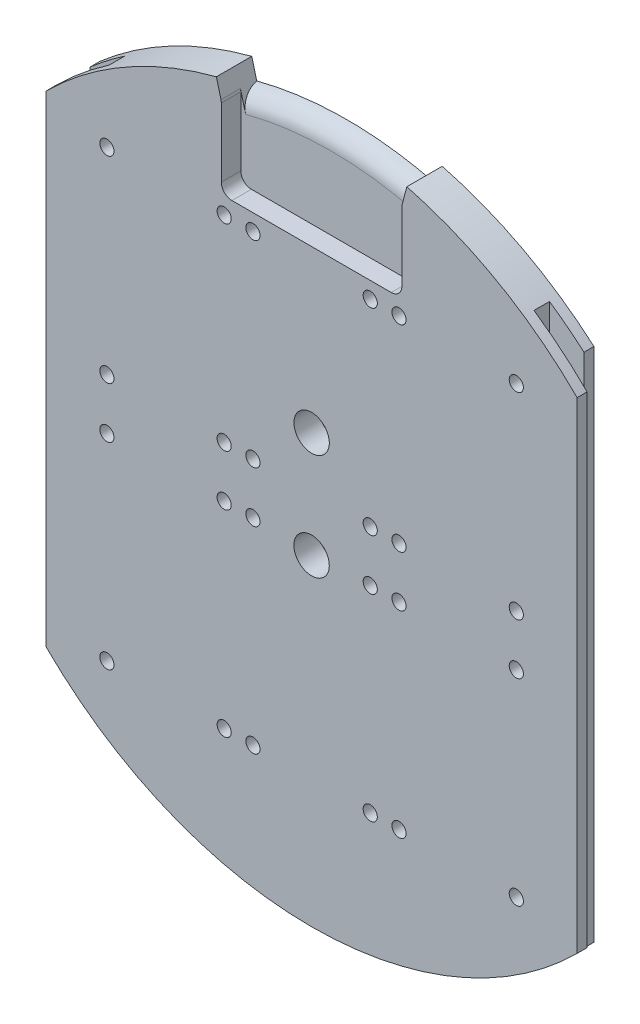
from build123d import *

# Parameters (mm, degrees)
RESSALTO_EXTRUS_O1_DEPTH = 8
ESBO_O5_R                = 4
CORTE_EXTRUS_O3_DEPTH    = 5.6
ESBO_O7_R                = 1.6
CORTE_EXTRUS_O4_DEPTH    = 180.714977127
CORTE_EXTRUS_O6_DEPTH    = 180.714977127
CORTE_EXTRUS_O7_DEPTH    = 4.4
FILETE1_R                = 2.4
FILETE2_R                = 4.4
ESBO_O11_W               = 3.5
ESBO_O11_H               = 150
CORTE_EXTRUS_O8_DEPTH    = 12
ESBO_O12_W               = 3.5
ESBO_O12_H               = 150
CORTE_EXTRUS_O9_DEPTH    = 12
ESBO_O13_W               = 4.4
ESBO_O13_H               = 156.816425971
CORTE_EXTRUS_O10_DEPTH   = 5.75


with BuildPart() as part:
    # Esboço1 → Ressalto-extrusão1 (new body)
    with BuildSketch(Plane.XY):
        with BuildLine():
            Line((0, 0), (0, -108.75))
            ThreePointArc((0, -108.75), (60, -133.542027106), (120, -108.75))
            Line((120, -108.75), (120, 0))
            ThreePointArc((120, 0), (60, 24.792027106), (0, 0))
        make_face()
    extrude(amount=RESSALTO_EXTRUS_O1_DEPTH)

    # Esboço5 → Corte-extrusão3 (cut)
    with BuildSketch(Plane.XY.offset(8)):
        with Locations((60, -60.875)):
            Circle(ESBO_O5_R)
        with Locations(Location((60, -36.875, 0), (0, 0, 180))):
            Circle(ESBO_O5_R)
    extrude(amount=-CORTE_EXTRUS_O3_DEPTH, mode=Mode.SUBTRACT)

    # Esboço7 → Corte-extrusão4 (cut, through all)
    with BuildSketch(Plane(origin=(0, 0, 0), x_dir=(-1, 0, 0), z_dir=(0, 0, -1))):
        with Locations((-73.25, -48.625)):
            Circle(ESBO_O7_R)
        with Locations((-79.75, -48.625)):
            Circle(ESBO_O7_R)
        with Locations((-106.25, -48.625)):
            Circle(ESBO_O7_R)
        with Locations(Location((-73.25, -4.125, 0), (0, 0, 180))):
            Circle(ESBO_O7_R)
        with Locations(Location((-106.25, -4.125, 0), (0, 0, 180))):
            Circle(ESBO_O7_R)
        with Locations(Location((-79.75, -4.125, 0), (0, 0, 180))):
            Circle(ESBO_O7_R)
        with Locations((-40.25, -4.125)):
            Circle(ESBO_O7_R)
        with Locations((-13.75, -4.125)):
            Circle(ESBO_O7_R)
        with Locations((-46.75, -4.125)):
            Circle(ESBO_O7_R)
        with Locations(Location((-13.75, -48.625, 0), (0, 0, 180))):
            Circle(ESBO_O7_R)
        with Locations(Location((-40.25, -48.625, 0), (0, 0, 180))):
            Circle(ESBO_O7_R)
        with Locations(Location((-46.75, -48.625, 0), (0, 0, 180))):
            Circle(ESBO_O7_R)
        with Locations((-46.75, -60.125)):
            Circle(ESBO_O7_R)
        with Locations((-40.25, -60.125)):
            Circle(ESBO_O7_R)
        with Locations((-13.75, -60.125)):
            Circle(ESBO_O7_R)
        with Locations(Location((-46.75, -104.625, 0), (0, 0, 180))):
            Circle(ESBO_O7_R)
        with Locations(Location((-13.75, -104.625, 0), (0, 0, 180))):
            Circle(ESBO_O7_R)
        with Locations(Location((-40.25, -104.625, 0), (0, 0, 180))):
            Circle(ESBO_O7_R)
        with Locations((-79.75, -104.625)):
            Circle(ESBO_O7_R)
        with Locations((-106.25, -104.625)):
            Circle(ESBO_O7_R)
        with Locations((-73.25, -104.625)):
            Circle(ESBO_O7_R)
        with Locations(Location((-106.25, -60.125, 0), (0, 0, 180))):
            Circle(ESBO_O7_R)
        with Locations(Location((-79.75, -60.125, 0), (0, 0, 180))):
            Circle(ESBO_O7_R)
        with Locations(Location((-73.25, -60.125, 0), (0, 0, 180))):
            Circle(ESBO_O7_R)
    extrude(amount=-CORTE_EXTRUS_O4_DEPTH, mode=Mode.SUBTRACT)

    # Esboço9 → Corte-extrusão6 (cut, through all)
    with BuildSketch(Plane.XY.offset(8)):
        with BuildLine():
            Line((39.6, 17.767664327), (38.486352357, 22.024398865))
            ThreePointArc((38.486352357, 22.024398865), (60, 24.792027106), (81.513647643, 22.024398865))
            Line((81.513647643, 22.024398865), (80.4, 17.767664327))
            ThreePointArc((80.4, 17.767664327), (60, 20.392027106), (39.6, 17.767664327))
        make_face()
    extrude(amount=-CORTE_EXTRUS_O6_DEPTH, mode=Mode.SUBTRACT)

    # Esboço10 → Corte-extrusão7 (cut)
    with BuildSketch(Plane.XY.offset(8)):
        with BuildLine():
            Line((39.6, 17.767664327), (39.6, -0.432335673))
            Line((39.6, -0.432335673), (80.4, -0.432335673))
            Line((80.4, -0.432335673), (80.4, 17.767664327))
            ThreePointArc((80.4, 17.767664327), (60, 20.392027106), (39.6, 17.767664327))
        make_face()
    extrude(amount=-CORTE_EXTRUS_O7_DEPTH, mode=Mode.SUBTRACT)

    # Filete1
    filete1_edges = [part.edges().sort_by_distance(p)[0] for p in [
        (80.4, -0.432335673, 5.8),
        (39.6, -0.432335673, 5.8),
        (39.6, 17.767664327, 5.8),
        (80.4, 17.767664327, 5.8),
    ]]
    fillet(filete1_edges, radius=FILETE1_R)

    # Filete2
    # the kernel refuses this fillet: 4.4 mm, written as the material it takes off along each edge
    with BuildSketch(Plane(origin=(60, -60.207972894, 3.6), x_dir=(0.25310173697270616, 0.9674396677526714, 0), z_dir=(0.9674396677526714, -0.25310173697270616, 0))) as filete2_piece_1:
        with BuildLine():
            CenterArc((76.273338469, -4.4), FILETE2_R, 10.475681696, 79.524318304)
            Line((80.6, -3.6), (80.6, 0))
            Line((80.6, 0), (76.273338469, 0))
        make_face()
    revolve(axis=Axis((60, -60.207972894, 3.6), (0, 0, 1)), revolution_arc=29.322266437, mode=Mode.SUBTRACT)

    # Esboço11 → Corte-extrusão8 (cut)
    with BuildSketch(Plane.ZY):
        with Locations((4, -53.75)):
            Rectangle(ESBO_O11_W, ESBO_O11_H)
    extrude(amount=-CORTE_EXTRUS_O8_DEPTH, mode=Mode.SUBTRACT)

    # Esboço12 → Corte-extrusão9 (cut)
    with BuildSketch(Plane(origin=(120, 0, 0), x_dir=(0, 0, -1), z_dir=(1, 0, 0))):
        with Locations((-4, -53.75)):
            Rectangle(ESBO_O12_W, ESBO_O12_H)
    extrude(amount=-CORTE_EXTRUS_O9_DEPTH, mode=Mode.SUBTRACT)

    # Esboço13 → Corte-extrusão10 (cut)
    with BuildSketch(Plane(origin=(0, 0, 0), x_dir=(-1, 0, 0), z_dir=(0, 0, -1))):
        with Locations((-118, -55.758814121)):
            Rectangle(ESBO_O13_W, ESBO_O13_H)
        with Locations((-2, -55.758814121)):
            Rectangle(ESBO_O13_W, ESBO_O13_H)
    extrude(amount=-CORTE_EXTRUS_O10_DEPTH, mode=Mode.SUBTRACT)


solid = part.part
